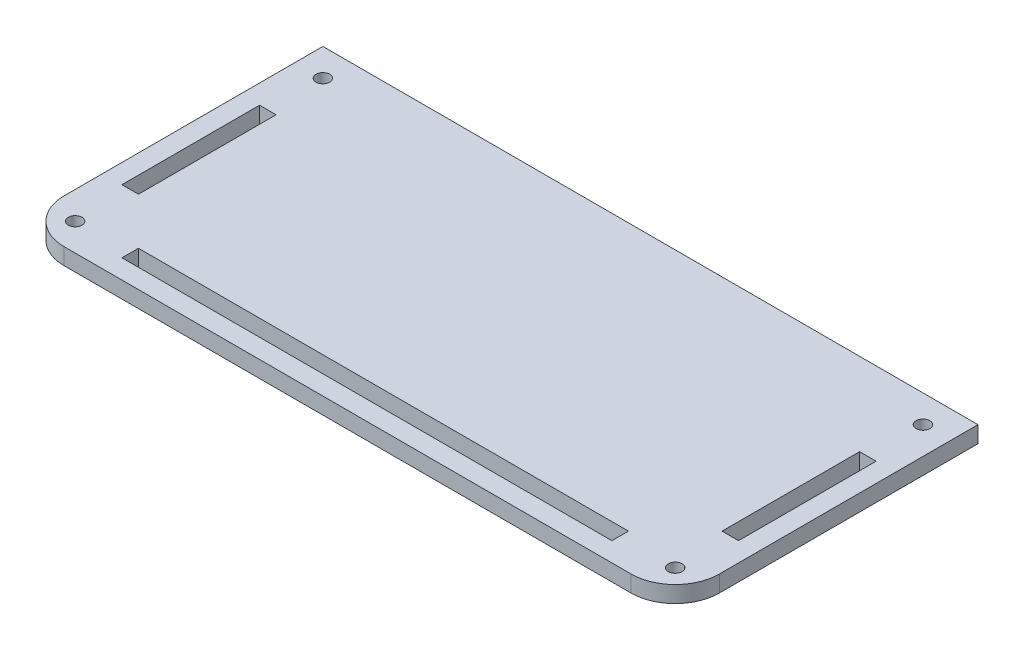
from build123d import *

# Parameters (mm, degrees)
SCHIZZO1_W                   = 119
SCHIZZO1_H                   = 55
ESTRUSIONE_ESTRUSIONE1_DEPTH = 3
FORO_FILETTATO_M3X0_5_1_D    = 2.5
SCHIZZO4_W                   = 89
SCHIZZO4_H                   = 3
SCHIZZO4_W_2                 = 3
SCHIZZO4_H_2                 = 25
TAGLIO_ESTRUSIONE1_DEPTH     = 66.616308948
RACCORDO1_R                  = 8


with BuildPart() as part:
    # Schizzo1 → Estrusione-Estrusione1 (new body)
    with BuildSketch(Plane(origin=(0, 0, 0), x_dir=(1, 0, 0), z_dir=(0, 1, 0))):
        Rectangle(SCHIZZO1_W, SCHIZZO1_H)
    extrude(amount=ESTRUSIONE_ESTRUSIONE1_DEPTH)

    # Foro filettato M3x0.5-1 (through all)
    with Locations(Plane(origin=(0, 3, 0), x_dir=(1, 0, 0), z_dir=(0, 1, 0))):
        with Locations((-54.5, -22.5), (54.5, -22.5), (54.5, 22.5), (-54.5, 22.5)):
            Hole(FORO_FILETTATO_M3X0_5_1_D / 2)

    # Schizzo4 → Taglio-Estrusione1 (cut, through all)
    with BuildSketch(Plane(origin=(0, 3, 0), x_dir=(1, 0, 0), z_dir=(0, 1, 0))):
        with Locations((0, -22.5)):
            Rectangle(SCHIZZO4_W, SCHIZZO4_H)
        with Locations((54.5, 0)):
            Rectangle(SCHIZZO4_W_2, SCHIZZO4_H_2)
        with Locations((-54.5, 0)):
            Rectangle(SCHIZZO4_W_2, SCHIZZO4_H_2)
    extrude(amount=-TAGLIO_ESTRUSIONE1_DEPTH, mode=Mode.SUBTRACT)

    # Raccordo1
    raccordo1_edges = [part.edges().sort_by_distance(p)[0] for p in [
        (-59.5, 1.5, 27.5),
        (59.5, 1.5, 27.5),
    ]]
    fillet(raccordo1_edges, radius=RACCORDO1_R)


solid = part.part
